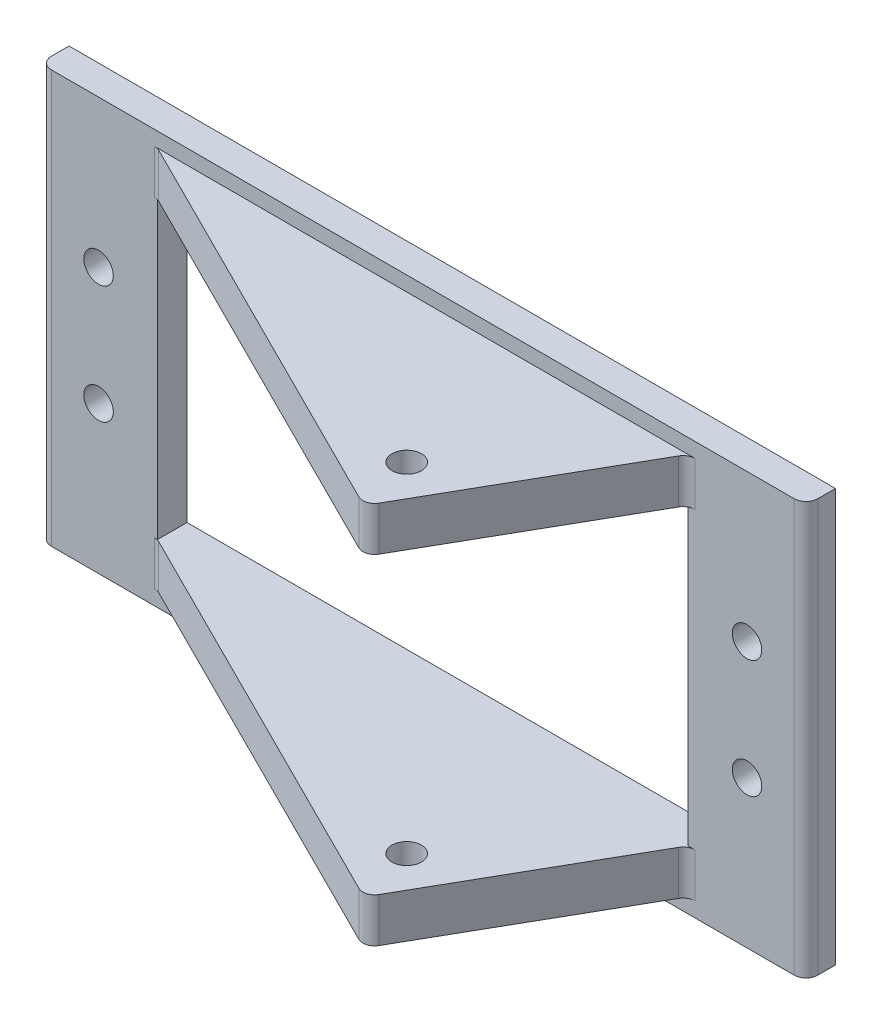
from build123d import *

# Parameters (mm, degrees)
SKETCH1_W           = 165.1
SKETCH1_H           = 88.9
BOSS_EXTRUDE1_DEPTH = 50.8
SKETCH2_R           = 3.175
SKETCH2_W           = 114.3
SKETCH2_H           = 63.5
CUT_EXTRUDE1_DEPTH  = 107.634633211
SKETCH4_W           = 165.1
SKETCH4_H           = 88.9
SKETCH4_W_2         = 114.3
SKETCH4_H_2         = 82.55
CUT_EXTRUDE2_DEPTH  = 44.45
SKETCH5_R           = 3.175
CUT_EXTRUDE4_DEPTH  = 130.398292589
FILLET2_R           = 2.54


with BuildPart() as part:
    # Sketch1 → Boss-Extrude1 (new body)
    with BuildSketch(Plane.XY):
        Rectangle(SKETCH1_W, SKETCH1_H)
    extrude(amount=BOSS_EXTRUDE1_DEPTH)

    # Sketch2 → Cut-Extrude1 (cut, through all)
    with BuildSketch(Plane.XY.offset(50.8)):
        with Locations((-69.85, 12.7)):
            Circle(SKETCH2_R)
        with Locations((-69.85, -12.7)):
            Circle(SKETCH2_R)
        with Locations((69.85, -12.7)):
            Circle(SKETCH2_R)
        with Locations((69.85, 12.7)):
            Circle(SKETCH2_R)
        Rectangle(SKETCH2_W, SKETCH2_H)
    extrude(amount=-CUT_EXTRUDE1_DEPTH, mode=Mode.SUBTRACT)

    # Sketch4 → Cut-Extrude2 (cut)
    with BuildSketch(Plane.XY.offset(50.8)):
        Rectangle(SKETCH4_W, SKETCH4_H)
        Rectangle(SKETCH4_W_2, SKETCH4_H_2, mode=Mode.SUBTRACT)
    extrude(amount=-CUT_EXTRUDE2_DEPTH, mode=Mode.SUBTRACT)

    # Sketch5 → Cut-Extrude4 (cut, through all)
    with BuildSketch(Plane.XZ.offset(41.275)):
        Polygon((-57.15, 6.35), (31.75, 50.8), (-57.15, 50.8), align=None)
        Polygon((31.75, 50.8), (57.15, 6.35), (57.15, 50.8), align=None)
        with Locations((28.286363636, 38.1)):
            Circle(SKETCH5_R)
    extrude(amount=-CUT_EXTRUDE4_DEPTH, mode=Mode.SUBTRACT)

    # Fillet2
    fillet2_edges = [part.edges().sort_by_distance(p)[0] for p in [
        (82.55, 0, 6.35),
        (57.15, 36.5125, 6.35),
        (57.15, -36.5125, 6.35),
        (31.75, -36.5125, 50.8),
        (31.75, 36.5125, 50.8),
        (-57.15, -36.5125, 6.35),
        (-57.15, 36.5125, 6.35),
        (-82.55, 0, 6.35),
    ]]
    fillet(fillet2_edges, radius=FILLET2_R)


solid = part.part
